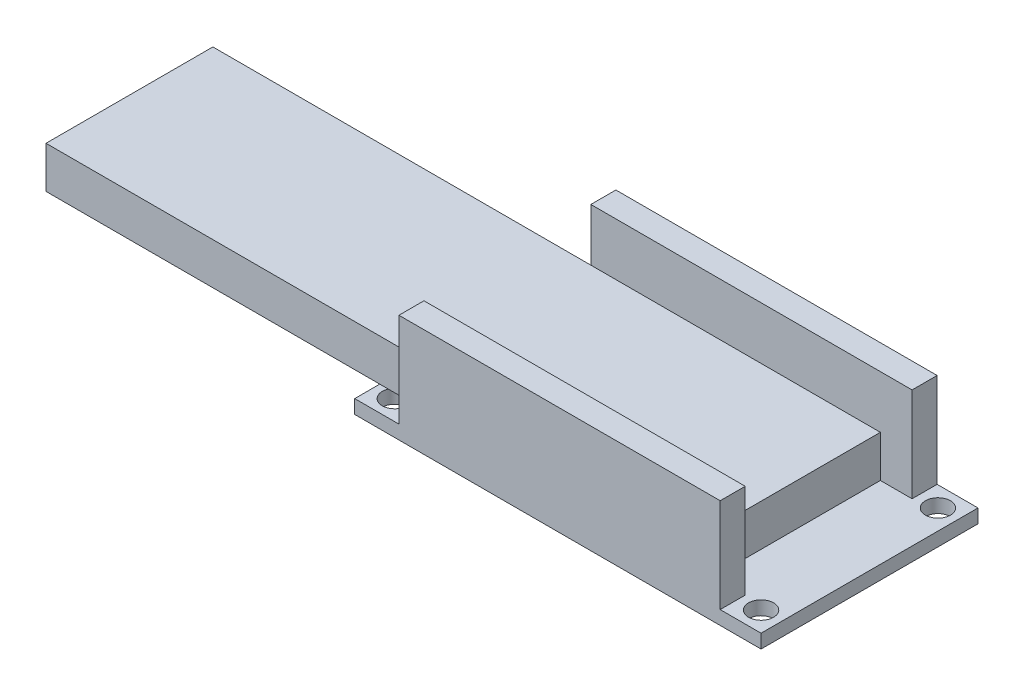
from build123d import *

# Parameters (mm, degrees)
SKETCH1_W           = 48.7
SKETCH1_H           = 26
SKETCH1_R           = 1.5
BOSS_EXTRUDE1_DEPTH = 1.65
SKETCH2_W           = 38.5
SKETCH2_H           = 3
BOSS_EXTRUDE2_DEPTH = 11.3
SKETCH3_W           = 80
SKETCH3_H           = 20
BOSS_EXTRUDE3_DEPTH = 5


with BuildPart() as part:
    # Sketch1 → Boss-Extrude1 (new body)
    with BuildSketch(Plane(origin=(0, 0, 0), x_dir=(1, 0, 0), z_dir=(0, 1, 0))):
        Rectangle(SKETCH1_W, SKETCH1_H)
        with Locations((-21.95, 10.6)):
            Circle(SKETCH1_R, mode=Mode.SUBTRACT)
        with Locations((-21.95, -10.6)):
            Circle(SKETCH1_R, mode=Mode.SUBTRACT)
        with Locations((21.95, -10.6)):
            Circle(SKETCH1_R, mode=Mode.SUBTRACT)
        with Locations((21.95, 10.6)):
            Circle(SKETCH1_R, mode=Mode.SUBTRACT)
    extrude(amount=BOSS_EXTRUDE1_DEPTH)

    # Sketch2 → Boss-Extrude2 (add)
    with BuildSketch(Plane(origin=(0, 1.65, 0), x_dir=(1, 0, 0), z_dir=(0, 1, 0))):
        with Locations((0.2, 11.5)):
            Rectangle(SKETCH2_W, SKETCH2_H)
        with Locations((0.2, -11.5)):
            Rectangle(SKETCH2_W, SKETCH2_H)
    extrude(amount=BOSS_EXTRUDE2_DEPTH)

    # Sketch3 → Boss-Extrude3 (add)
    with BuildSketch(Plane(origin=(0, 1.65, 0), x_dir=(1, 0, 0), z_dir=(0, 1, 0))):
        with Locations((-24.35, 0)):
            Rectangle(SKETCH3_W, SKETCH3_H)
    extrude(amount=BOSS_EXTRUDE3_DEPTH)


solid = part.part
